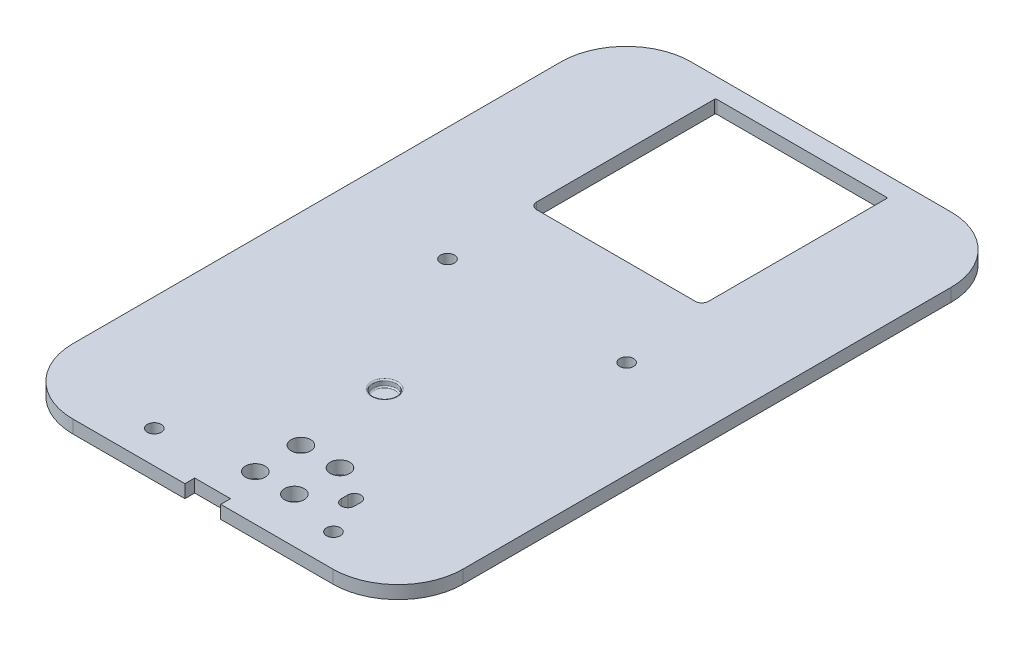
from build123d import *

# Parameters (mm, degrees)
TOP_DEPTH                 = 2.54
SKETCH7_R                 = 1.905
BUTTONLEDCUT_DEPTH        = 72.306909304
SKETCH8_W                 = 33.528
SKETCH8_H                 = 36.195
SOLARCUT_DEPTH            = 72.306909304
F_6_32_TAPPED_HOLE1_D     = 2.7051
F_6_32_TAPPED_HOLE1_DEPTH = 11.176
F_6_32_TAPPED_HOLE1_TIP   = 0.81269403
SKETCH13_W                = 12.446
SKETCH13_H                = 1.27
BODY_TABS_DEPTH           = 1.27
BODY_TABS_DRAFT           = 7
BODY_TABS_PROFILE_2_DEPTH = 1.27
BODY_TABS_PROFILE_2_DRAFT = 7
SKETCH14_W                = 6.985
SKETCH14_H                = 1.905
FLAT_HEAD_HOLE_DEPTH      = 73.383371188
FILLET1_R                 = 1.27
FILLET2_R                 = 0.254
SKETCH16_R                = 2.286
SOLAR_SOLDER_HOLE_DEPTH   = 1.27
FILLET3_R                 = 0.254


with BuildPart() as part:
    # Sketch2 → top (new body)
    with BuildSketch(Plane(origin=(0, 0, 0), x_dir=(1, 0, 0), z_dir=(0, 1, 0))):
        with BuildLine():
            Line((-25.3365, -60.2615), (25.3365, -60.2615))
            ThreePointArc((25.3365, -60.2615), (34.316756121, -56.541756121), (38.0365, -47.5615))
            Line((38.0365, -47.5615), (38.0365, 47.5615))
            ThreePointArc((38.0365, 47.5615), (34.316756121, 56.541756121), (25.3365, 60.2615))
            Line((25.3365, 60.2615), (-25.3365, 60.2615))
            ThreePointArc((-25.3365, 60.2615), (-34.316756121, 56.541756121), (-38.0365, 47.5615))
            Line((-38.0365, 47.5615), (-38.0365, -47.5615))
            ThreePointArc((-38.0365, -47.5615), (-34.316756121, -56.541756121), (-25.3365, -60.2615))
        make_face()
    extrude(amount=TOP_DEPTH)

    # Sketch7 → ButtonLEDCut (cut, through all)
    with BuildSketch(Plane(origin=(0, 2.54, 0), x_dir=(1, 0, 0), z_dir=(0, 1, 0))):
        with Locations((1.3335, -51.3715)):
            Circle(SKETCH7_R)
        with Locations((8.9535, -51.3715)):
            Circle(SKETCH7_R)
        with Locations((8.9535, -42.4815)):
            Circle(SKETCH7_R)
        with Locations((1.3335, -42.4815)):
            Circle(SKETCH7_R)
        with BuildLine():
            Line((16.8275, -46.2915), (16.8275, -47.5615))
            ThreePointArc((16.8275, -47.5615), (15.5575, -48.8315), (14.2875, -47.5615))
            Line((14.2875, -47.5615), (14.2875, -46.2915))
            ThreePointArc((14.2875, -46.2915), (15.5575, -45.0215), (16.8275, -46.2915))
        make_face()
    extrude(amount=-BUTTONLEDCUT_DEPTH, mode=Mode.SUBTRACT)

    # Sketch8 → SolarCut (cut, through all)
    with BuildSketch(Plane(origin=(0, 2.54, 0), x_dir=(1, 0, 0), z_dir=(0, 1, 0))):
        with Locations((0, 38.354)):
            Rectangle(SKETCH8_W, SKETCH8_H)
    extrude(amount=-SOLARCUT_DEPTH, mode=Mode.SUBTRACT)

    # #6-32 Tapped Hole1
    with Locations(Plane(origin=(0, 2.54, 0), x_dir=(1, 0, 0), z_dir=(0, 1, 0))):
        with Locations((-15.8115, 3.2385), (19.1135, 3.2385), (19.1135, -53.9115), (-15.8115, -53.9115)):
            Hole(F_6_32_TAPPED_HOLE1_D / 2, depth=F_6_32_TAPPED_HOLE1_DEPTH)
            with Locations((0, 0, -(F_6_32_TAPPED_HOLE1_DEPTH + F_6_32_TAPPED_HOLE1_TIP / 2))):  # 118° drill point
                Cone(0, F_6_32_TAPPED_HOLE1_D / 2, F_6_32_TAPPED_HOLE1_TIP, mode=Mode.SUBTRACT)


with BuildPart() as body_tabs_tool:
    # Sketch13 → Body Tabs (with draft: the straight prism first)
    with BuildSketch(Plane(origin=(0, 0, -60.2615), x_dir=(-1, 0, 0), z_dir=(0, 0, -1))):
        with Locations((-12.7, 0.635)):
            Rectangle(SKETCH13_W, SKETCH13_H)
    extrude(amount=BODY_TABS_DEPTH)
    # Body Tabs: the draft: its side faces are tilted about the plane it starts from
    body_tabs_sides = [body_tabs_tool.faces().sort_by_distance(p)[0] for p in [
        (12.7, 0, -60.8965),
        (6.477, 0.635, -60.8965),
        (12.7, 1.27, -60.8965),
        (18.923, 0.635, -60.8965),
    ]]
    draft(body_tabs_sides, Plane(origin=(0, 0, -60.2615), x_dir=(-1, 0, 0), z_dir=(0, 0, -1)), BODY_TABS_DRAFT)


with BuildPart() as part_1:
    add(part.part)

    # Body Tabs: add body_tabs_tool
    add(body_tabs_tool.part)


with BuildPart() as body_tabs_profile_2_tool:
    # Sketch13 → Body Tabs profile 2 (with draft: the straight prism first)
    with BuildSketch(Plane(origin=(0, 0, -60.2615), x_dir=(-1, 0, 0), z_dir=(0, 0, -1))):
        with Locations((12.7, 0.635)):
            Rectangle(SKETCH13_W, SKETCH13_H)
    extrude(amount=BODY_TABS_PROFILE_2_DEPTH)
    # Body Tabs profile 2: the draft: its side faces are tilted about the plane it starts from
    body_tabs_profile_2_sides = [body_tabs_profile_2_tool.faces().sort_by_distance(p)[0] for p in [
        (-18.923, 0.635, -60.8965),
        (-12.7, 1.27, -60.8965),
        (-6.477, 0.635, -60.8965),
        (-12.7, 0, -60.8965),
    ]]
    draft(body_tabs_profile_2_sides, Plane(origin=(0, 0, -60.2615), x_dir=(-1, 0, 0), z_dir=(0, 0, -1)), BODY_TABS_PROFILE_2_DRAFT)


with BuildPart() as part_2:
    add(part_1.part)

    # Body Tabs profile 2: add body_tabs_profile_2_tool
    add(body_tabs_profile_2_tool.part)

    # Sketch14 → Flat Head Hole (cut, through all)
    with BuildSketch(Plane(origin=(0, 2.54, 0), x_dir=(1, 0, 0), z_dir=(0, 1, 0))):
        with Locations((0, -59.309)):
            Rectangle(SKETCH14_W, SKETCH14_H)
    extrude(amount=-FLAT_HEAD_HOLE_DEPTH, mode=Mode.SUBTRACT)

    # Fillet1
    fillet1_edges = [part_2.edges().sort_by_distance(p)[0] for p in [
        (16.764, 1.27, -20.2565),
        (-16.764, 1.27, -20.2565),
    ]]
    fillet(fillet1_edges, radius=FILLET1_R)

    # Fillet2
    fillet2_edges = [part_2.edges().sort_by_distance(p)[0] for p in [
        (16.764, 1.27, -56.4515),
        (-16.764, 1.27, -56.4515),
    ]]
    fillet(fillet2_edges, radius=FILLET2_R)

    # Sketch16 → solar solder hole (cut)
    with BuildSketch(Plane(origin=(0, 2.54, 0), x_dir=(1, 0, 0), z_dir=(0, 1, 0))):
        with Locations((0, -24.8285)):
            Circle(SKETCH16_R)
    extrude(amount=-SOLAR_SOLDER_HOLE_DEPTH, mode=Mode.SUBTRACT)

    # Fillet3
    fillet3_edges = [part_2.edges().sort_by_distance(p)[0] for p in [
        (-2.286, 2.54, 24.8285),
        (-2.286, 1.27, 24.8285),
    ]]
    fillet(fillet3_edges, radius=FILLET3_R)


solid = part_2.part
